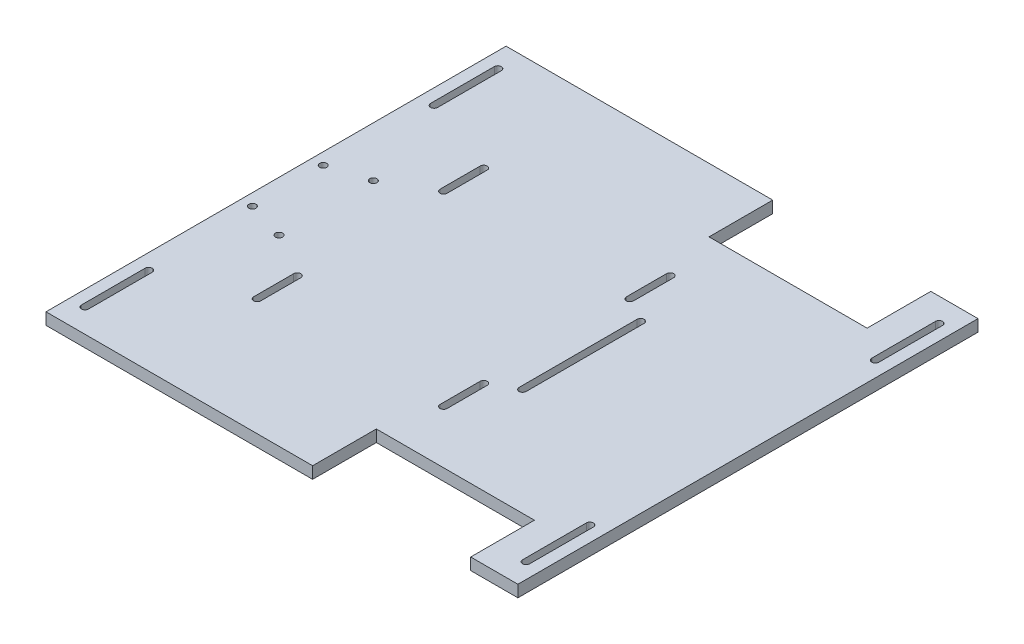
from build123d import *

# Parameters (mm, degrees)
SKETCH2_W           = 200
SKETCH2_H           = 195
BOSS_EXTRUDE1_DEPTH = 5
CUT_EXTRUDE1_DEPTH  = 140.754248594
SKETCH4_W           = 67
SKETCH4_H           = 27
CUT_EXTRUDE2_DEPTH  = 140.754248594
CUT_EXTRUDE4_DEPTH  = 140.754248594
CUT_EXTRUDE5_DEPTH  = 140.754248594
SKETCH8_R           = 1.5
CUT_EXTRUDE6_DEPTH  = 140.754248594
SKETCH9_R           = 1.5
CUT_EXTRUDE7_DEPTH  = 140.754248594


with BuildPart() as part:
    # Sketch2 → Boss-Extrude1 (new body)
    with BuildSketch(Plane(origin=(0, 0, 0), x_dir=(1, 0, 0), z_dir=(0, 1, 0))):
        Rectangle(SKETCH2_W, SKETCH2_H)
    extrude(amount=BOSS_EXTRUDE1_DEPTH)

    # Sketch3 → Cut-Extrude1 (cut, through all)
    with BuildSketch(Plane(origin=(0, 5, 0), x_dir=(1, 0, 0), z_dir=(0, 1, 0))):
        with BuildLine():
            Line((-95, -87.5), (-95, -60.5))
            ThreePointArc((-95, -60.5), (-93.5, -59), (-92, -60.5))
            Line((-92, -60.5), (-92, -87.5))
            ThreePointArc((-92, -87.5), (-93.5, -89), (-95, -87.5))
        make_face()
        with BuildLine():
            Line((-95, 87.5), (-95, 60.5))
            ThreePointArc((-95, 60.5), (-93.5, 59), (-92, 60.5))
            Line((-92, 60.5), (-92, 87.5))
            ThreePointArc((-92, 87.5), (-93.5, 89), (-95, 87.5))
        make_face()
        with BuildLine():
            Line((95, 87.5), (95, 60.5))
            ThreePointArc((95, 60.5), (93.5, 59), (92, 60.5))
            Line((92, 60.5), (92, 87.5))
            ThreePointArc((92, 87.5), (93.5, 89), (95, 87.5))
        make_face()
        with BuildLine():
            Line((95, -87.5), (95, -60.5))
            ThreePointArc((95, -60.5), (93.5, -59), (92, -60.5))
            Line((92, -60.5), (92, -87.5))
            ThreePointArc((92, -87.5), (93.5, -89), (95, -87.5))
        make_face()
    extrude(amount=-CUT_EXTRUDE1_DEPTH, mode=Mode.SUBTRACT)

    # Sketch4 → Cut-Extrude2 (cut, through all)
    with BuildSketch(Plane.XZ):
        with Locations((46.5, -84)):
            Rectangle(SKETCH4_W, SKETCH4_H)
        with Locations((46.5, 84)):
            Rectangle(SKETCH4_W, SKETCH4_H)
    extrude(amount=-CUT_EXTRUDE2_DEPTH, mode=Mode.SUBTRACT)

    # Sketch5 → Cut-Extrude4 (cut, through all)
    with BuildSketch(Plane.XZ):
        with BuildLine():
            Line((-61.5, -48), (-61.5, -31))
            ThreePointArc((-61.5, -31), (-60, -29.5), (-58.5, -31))
            Line((-58.5, -31), (-58.5, -48))
            ThreePointArc((-58.5, -48), (-60, -49.5), (-61.5, -48))
        make_face()
        with BuildLine():
            Line((-61.5, 48), (-61.5, 31))
            ThreePointArc((-61.5, 31), (-60, 29.5), (-58.5, 31))
            Line((-58.5, 31), (-58.5, 48))
            ThreePointArc((-58.5, 48), (-60, 49.5), (-61.5, 48))
        make_face()
        with BuildLine():
            Line((20.5, 48), (20.5, 31))
            ThreePointArc((20.5, 31), (19, 29.5), (17.5, 31))
            Line((17.5, 31), (17.5, 48))
            ThreePointArc((17.5, 48), (19, 49.5), (20.5, 48))
        make_face()
        with BuildLine():
            Line((20.5, -48), (20.5, -31))
            ThreePointArc((20.5, -31), (19, -29.5), (17.5, -31))
            Line((17.5, -31), (17.5, -48))
            ThreePointArc((17.5, -48), (19, -49.5), (20.5, -48))
        make_face()
    extrude(amount=-CUT_EXTRUDE4_DEPTH, mode=Mode.SUBTRACT)

    # Sketch7 → Cut-Extrude5 (cut, through all)
    with BuildSketch(Plane.XZ):
        with BuildLine():
            Line((28, -25), (28, 25))
            ThreePointArc((28, 25), (29.5, 26.5), (31, 25))
            Line((31, 25), (31, -25))
            ThreePointArc((31, -25), (29.5, -26.5), (28, -25))
        make_face()
    extrude(amount=-CUT_EXTRUDE5_DEPTH, mode=Mode.SUBTRACT)

    # Sketch8 → Cut-Extrude6 (cut, through all)
    with BuildSketch(Plane(origin=(0, 5, 0), x_dir=(1, 0, 0), z_dir=(0, 1, 0))):
        with Locations((-78.75, -19.995)):
            Circle(SKETCH8_R)
        with Locations((-78.75, 19.995)):
            Circle(SKETCH8_R)
    extrude(amount=-CUT_EXTRUDE6_DEPTH, mode=Mode.SUBTRACT)

    # Sketch9 → Cut-Extrude7 (cut, through all)
    with BuildSketch(Plane(origin=(0, 5, 0), x_dir=(1, 0, 0), z_dir=(0, 1, 0))):
        with Locations((-95, 15)):
            Circle(SKETCH9_R)
        with Locations((-95, -15)):
            Circle(SKETCH9_R)
    extrude(amount=-CUT_EXTRUDE7_DEPTH, mode=Mode.SUBTRACT)


solid = part.part
